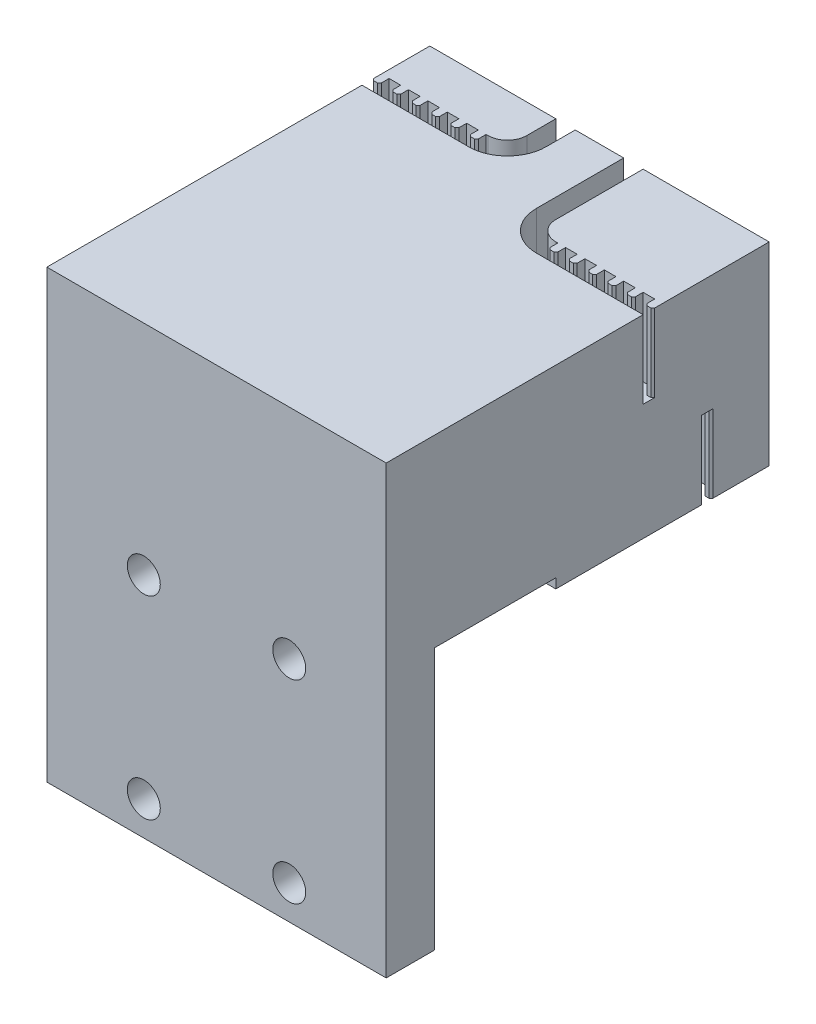
from build123d import *

# Parameters (mm, degrees)
SKETCH1_W           = 35
SKETCH1_H           = 22
BOSS_EXTRUDE1_DEPTH = 20
CUT_EXTRUDE1_DEPTH  = 8
CUT_EXTRUDE2_DEPTH  = 8
BOSS_EXTRUDE2_DEPTH = 8
BOSS_EXTRUDE4_DEPTH = 8
SKETCH9_W           = 35
SKETCH9_H           = 19
BOSS_EXTRUDE5_DEPTH = 12.5
SKETCH11_W          = 35
SKETCH11_H          = 46
BOSS_EXTRUDE6_DEPTH = 5
SKETCH12_R          = 1.7
CUT_EXTRUDE3_DEPTH  = 5


with BuildPart() as part:
    # Sketch1 → Boss-Extrude1 (new body)
    with BuildSketch(Plane(origin=(0, 0, 0), x_dir=(1, 0, 0), z_dir=(0, 1, 0))):
        with Locations((17.5, 11)):
            Rectangle(SKETCH1_W, SKETCH1_H)
    extrude(amount=BOSS_EXTRUDE1_DEPTH)

    # Sketch2 → Cut-Extrude1 (cut)
    with BuildSketch(Plane(origin=(0, 20, 0), x_dir=(1, 0, 0), z_dir=(0, 1, 0))):
        with BuildLine():
            Line((0, 15), (11, 15))
            ThreePointArc((11, 15), (13.828427125, 16.171572875), (15, 19))
            Line((15, 19), (15, 22))
            Line((15, 22), (13, 22))
            Line((13, 22), (13, 19))
            ThreePointArc((13, 19), (12.414213562, 17.585786438), (11, 17))
            Line((11, 17), (0, 17))
            Line((0, 17), (0, 15))
        make_face()
        with BuildLine():
            Line((35, 9), (24, 9))
            ThreePointArc((24, 9), (21.171572875, 10.171572875), (20, 13))
            Line((20, 13), (20, 22))
            Line((20, 22), (22, 22))
            Line((22, 22), (22, 13))
            ThreePointArc((22, 13), (22.585786438, 11.585786438), (24, 11))
            Line((24, 11), (35, 11))
            Line((35, 11), (35, 9))
        make_face()
    extrude(amount=-CUT_EXTRUDE1_DEPTH, mode=Mode.SUBTRACT)

    # Sketch5 → Cut-Extrude2 (cut)
    with BuildSketch(Plane(origin=(0, 0, 0), x_dir=(-1, 0, 0), z_dir=(0, -1, 0))):
        with BuildLine():
            Line((-35, 15), (-24, 15))
            ThreePointArc((-24, 15), (-21.171572875, 16.171572875), (-20, 19))
            Line((-20, 19), (-20, 22))
            Line((-20, 22), (-22, 22))
            Line((-22, 22), (-22, 19))
            ThreePointArc((-22, 19), (-22.585786438, 17.585786438), (-24, 17))
            Line((-24, 17), (-35, 17))
            Line((-35, 17), (-35, 15))
        make_face()
        with BuildLine():
            Line((0, 9), (-11, 9))
            ThreePointArc((-11, 9), (-13.828427125, 10.171572875), (-15, 13))
            Line((-15, 13), (-15, 22))
            Line((-15, 22), (-13, 22))
            Line((-13, 22), (-13, 13))
            ThreePointArc((-13, 13), (-12.414213562, 11.585786438), (-11, 11))
            Line((-11, 11), (0, 11))
            Line((0, 11), (0, 9))
        make_face()
    extrude(amount=-CUT_EXTRUDE2_DEPTH, mode=Mode.SUBTRACT)

    # Sketch6 → Boss-Extrude2 (add)
    with BuildSketch(Plane(origin=(0, 20, 0), x_dir=(1, 0, 0), z_dir=(0, 1, 0))):
        Polygon((0.2, 16), (0, 16.2), (0, 17), (0.8, 17), (0.8, 16.2), (0.6, 16), align=None)
        Polygon((2.2, 16), (2, 16.2), (2, 17), (2.8, 17), (2.8, 16.2), (2.6, 16), align=None)
        Polygon((4.2, 16), (4, 16.2), (4, 17), (4.8, 17), (4.8, 16.2), (4.6, 16), align=None)
        Polygon((6.2, 16), (6, 16.2), (6, 17), (6.8, 17), (6.8, 16.2), (6.6, 16), align=None)
        Polygon((8.2, 16), (8, 16.2), (8, 17), (8.8, 17), (8.8, 16.2), (8.6, 16), align=None)
        Polygon((10.2, 16), (10, 16.2), (10, 17), (10.8, 17), (10.8, 16.2), (10.6, 16), align=None)
        Polygon((34.4, 10), (34.2, 10.2), (34.2, 11), (35, 11), (35, 10.2), (34.8, 10), align=None)
        Polygon((32.4, 10), (32.2, 10.2), (32.2, 11), (33, 11), (33, 10.2), (32.8, 10), align=None)
        Polygon((30.4, 10), (30.2, 10.2), (30.2, 11), (31, 11), (31, 10.2), (30.8, 10), align=None)
        Polygon((28.4, 10), (28.2, 10.2), (28.2, 11), (29, 11), (29, 10.2), (28.8, 10), align=None)
        Polygon((26.4, 10), (26.2, 10.2), (26.2, 11), (27, 11), (27, 10.2), (26.8, 10), align=None)
        Polygon((24.4, 10), (24.2, 10.2), (24.2, 11), (25, 11), (25, 10.2), (24.8, 10), align=None)
    extrude(amount=-BOSS_EXTRUDE2_DEPTH)

    # Sketch8 → Boss-Extrude4 (add)
    with BuildSketch(Plane.XZ):
        Polygon((35, -17), (35, -16.2), (34.8, -16), (34.4, -16), (34.2, -16.2), (34.2, -17), align=None)
        Polygon((33, -17), (33, -16.2), (32.8, -16), (32.4, -16), (32.2, -16.2), (32.2, -17), align=None)
        Polygon((31, -17), (31, -16.2), (30.8, -16), (30.4, -16), (30.2, -16.2), (30.2, -17), align=None)
        Polygon((29, -17), (29, -16.2), (28.8, -16), (28.4, -16), (28.2, -16.2), (28.2, -17), align=None)
        Polygon((27, -17), (27, -16.2), (26.8, -16), (26.4, -16), (26.2, -16.2), (26.2, -17), align=None)
        Polygon((25, -17), (25, -16.2), (24.8, -16), (24.4, -16), (24.2, -16.2), (24.2, -17), align=None)
        Polygon((0.8, -11), (0.8, -10.2), (0.6, -10), (0.2, -10), (0, -10.2), (0, -11), align=None)
        Polygon((2.8, -11), (2.8, -10.2), (2.6, -10), (2.2, -10), (2, -10.2), (2, -11), align=None)
        Polygon((4.8, -11), (4.8, -10.2), (4.6, -10), (4.2, -10), (4, -10.2), (4, -11), align=None)
        Polygon((6.8, -11), (6.8, -10.2), (6.6, -10), (6.2, -10), (6, -10.2), (6, -11), align=None)
        Polygon((8.8, -11), (8.8, -10.2), (8.6, -10), (8.2, -10), (8, -10.2), (8, -11), align=None)
        Polygon((10.8, -11), (10.8, -10.2), (10.6, -10), (10.2, -10), (10, -10.2), (10, -11), align=None)
    extrude(amount=-BOSS_EXTRUDE4_DEPTH)

    # Sketch9 → Boss-Extrude5 (add)
    with BuildSketch(Plane.XY):
        with Locations((17.5, 10.5)):
            Rectangle(SKETCH9_W, SKETCH9_H)
    extrude(amount=BOSS_EXTRUDE5_DEPTH)

    # Sketch11 → Boss-Extrude6 (add)
    with BuildSketch(Plane.XY.offset(12.5)):
        with Locations((17.5, -3)):
            Rectangle(SKETCH11_W, SKETCH11_H)
    extrude(amount=BOSS_EXTRUDE6_DEPTH)

    # Sketch12 → Cut-Extrude3 (cut)
    with BuildSketch(Plane.XY.offset(17.5)):
        with Locations((10, -2.5)):
            Circle(SKETCH12_R)
        with Locations((25, -2.5)):
            Circle(SKETCH12_R)
        with Locations((25, -22.5)):
            Circle(SKETCH12_R)
        with Locations((10, -22.5)):
            Circle(SKETCH12_R)
    extrude(amount=-CUT_EXTRUDE3_DEPTH, mode=Mode.SUBTRACT)


solid = part.part
